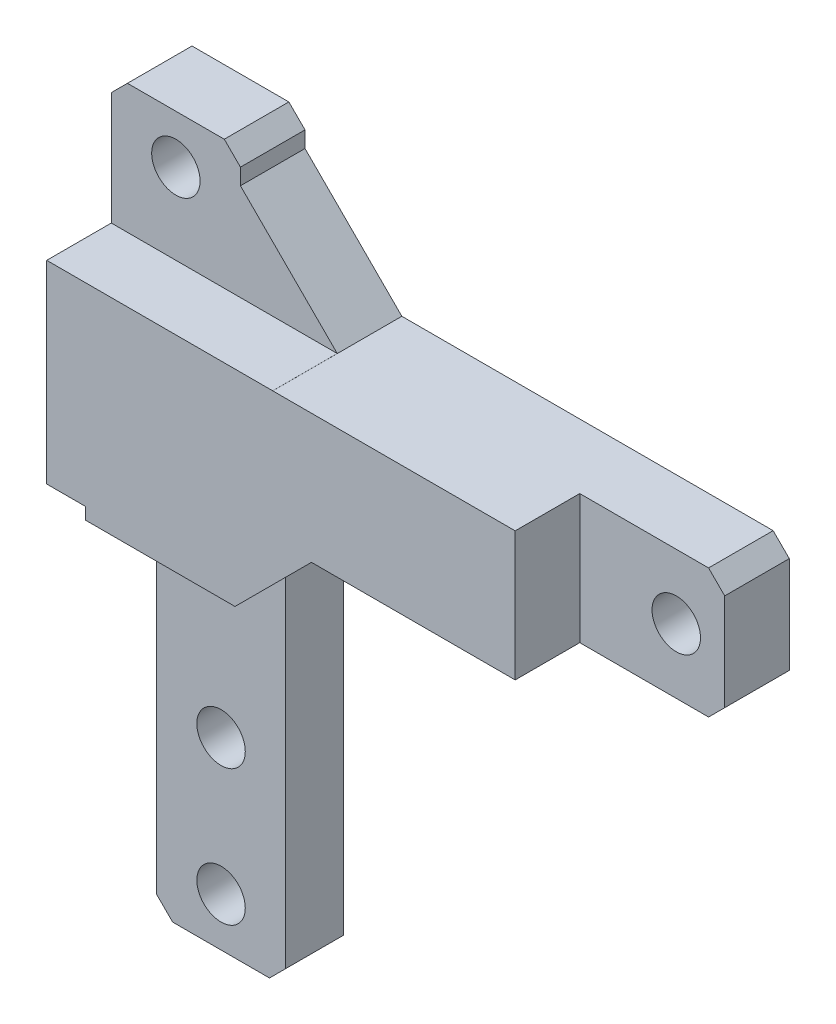
from build123d import *

# Parameters (mm, degrees)
SKETCH_1_R          = 0.75
EXTRUDE_1_DEPTH     = 4
CUT_EXTRUDE_START   = -2.2
SKETCH_2_W          = 4
SKETCH_2_H          = 11.631287185
SKETCH_2_R          = 0.75
CUT_EXTRUDE_1_DEPTH = 2.2
CUT_EXTRUDE_START_2 = 2
SKETCH_3_W          = 4.48994314
SKETCH_3_H          = 4
SKETCH_3_R          = 0.75
SKETCH_3_W_2        = 4
SKETCH_3_H_2        = 3.998874997
CUT_EXTRUDE_2_DEPTH = 2
CHAMFER_1_SIZE      = 3
CHAMFER_2_SIZE      = 0.5


with BuildPart() as part:
    # 草图1 → 凸台-拉伸1 (new body)
    with BuildSketch(Plane.XY):
        Polygon((-4.3, -2.5), (9.5, -2.5), (9.5, 1.5), (-5.5, 1.5), (-5.5, 5.5), (-9.5, 5.5), (-9.5, 1.5), (-9.5, -4.5), (-8.3, -4.5), (-8.3, -16.5), (-4.3, -16.5), align=None)
        with Locations((8, -0.5)):
            Circle(SKETCH_1_R, mode=Mode.SUBTRACT)
        with Locations((-7.5, 4)):
            Circle(SKETCH_1_R, mode=Mode.SUBTRACT)
        with Locations((-6.3, -15)):
            Circle(SKETCH_1_R, mode=Mode.SUBTRACT)
        with Locations((-6.3, -10.8)):
            Circle(SKETCH_1_R, mode=Mode.SUBTRACT)
    extrude(amount=EXTRUDE_1_DEPTH)

    # 草图2 → 切除-拉伸1 (cut)
    with BuildSketch(Plane.XY.offset(4).offset(CUT_EXTRUDE_START)):
        with Locations((-6.3, -10.684356408)):
            Rectangle(SKETCH_2_W, SKETCH_2_H)
        with Locations((-6.3, -15)):
            Circle(SKETCH_2_R, mode=Mode.SUBTRACT)
        with Locations((-6.3, -10.8)):
            Circle(SKETCH_2_R, mode=Mode.SUBTRACT)
    extrude(amount=CUT_EXTRUDE_1_DEPTH, mode=Mode.SUBTRACT)

    # 草图3 → 切除-拉伸2 (cut)
    # profile 1 of 2: a face of its own
    with BuildSketch(Plane(origin=(0, 0, 4), x_dir=(-1, 0, 0), z_dir=(0, 0, -1)).offset(CUT_EXTRUDE_START_2)):
        with Locations((-7.25502843, -0.5)):
            Rectangle(SKETCH_3_W, SKETCH_3_H)
        with Locations((-8, -0.5)):
            Circle(SKETCH_3_R, mode=Mode.SUBTRACT)
    # profile 2 of 2: a face of its own
    with BuildSketch(Plane(origin=(0, 0, 4), x_dir=(-1, 0, 0), z_dir=(0, 0, -1)).offset(CUT_EXTRUDE_START_2)):
        with Locations((7.5, 3.500562502)):
            Rectangle(SKETCH_3_W_2, SKETCH_3_H_2)
        with Locations((7.5, 4)):
            Circle(SKETCH_3_R, mode=Mode.SUBTRACT)
    extrude(amount=-CUT_EXTRUDE_2_DEPTH, mode=Mode.SUBTRACT)

    # 倒角1
    chamfer_1_edges = [part.edges().sort_by_distance(p)[0] for p in [
        (-4.3, -2.5, 2),
        (-5.5, 1.5, 2),
    ]]
    chamfer(chamfer_1_edges, length=CHAMFER_1_SIZE)

    # 倒角2
    chamfer_2_edges = [part.edges().sort_by_distance(p)[0] for p in [
        (-4.3, -16.5, 0.9),
        (-8.3, -16.5, 0.9),
        (-9.5, 5.5, 1),
        (9.5, -2.5, 1),
        (9.5, 1.5, 1),
        (-5.5, 5.5, 1),
    ]]
    chamfer(chamfer_2_edges, length=CHAMFER_2_SIZE)


solid = part.part
